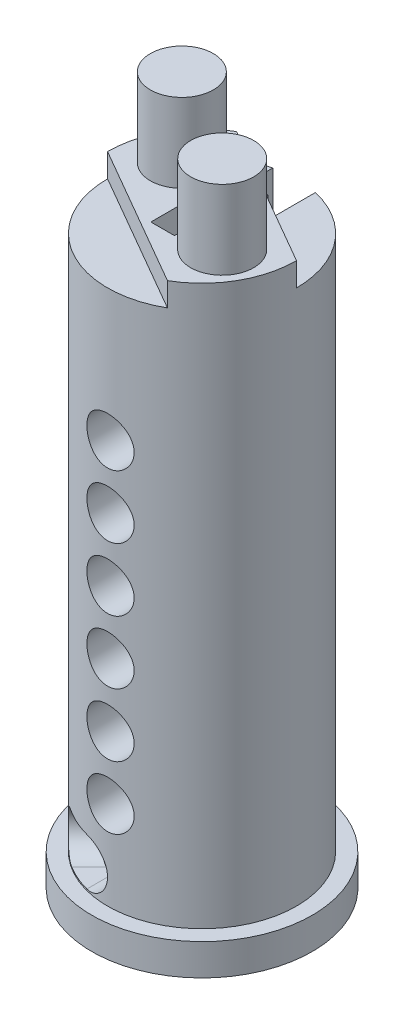
from build123d import *

# Parameters (mm, degrees)
SKETCH_1_R               = 7
EXTRUDE_1_DEPTH          = 2
SKETCH_2_R               = 6
EXTRUDE_2_DEPTH          = 35.5
CUT_EXTRUDE_1_DEPTH      = 39.784661917
CUT_EXTRUDE_1_DEPTH_BACK = 1.5
SKETCH_4_R               = 2
EXTRUDE_3_DEPTH          = 5
CUT_EXTRUDE_2_DEPTH      = 44.637713047
CUT_EXTRUDE_2_DEPTH_BACK = 44.637713047
CUT_EXTRUDE_6_OUTLINE_W  = 1.5
CUT_EXTRUDE_6_OUTLINE_H  = 7.50002714
PATTERN_LINEAR_2_COUNT   = 6
PATTERN_LINEAR_2_PITCH   = 4
CUT_EXTRUDE_7_DEPTH      = 1.5
FILLET_2_R               = 1.5
FILLET_3_R               = 1.5


# Read off the part's stored shape, not the designer's step: 切除-拉伸6
with BuildPart() as part:
    # 草图1 → 凸台-拉伸1 (new body)
    with BuildSketch(Plane(origin=(0, 0, 0), x_dir=(1, 0, 0), z_dir=(0, 1, 0))):
        with Locations(Location((0, 0, 0), (0, 0, 270))):
            Circle(SKETCH_1_R)
    extrude(amount=EXTRUDE_1_DEPTH)

    # 草图2 → 凸台-拉伸2 (add)
    with BuildSketch(Plane(origin=(0, 2, 0), x_dir=(1, 0, 0), z_dir=(0, 1, 0))):
        with Locations(Location((0, 0, 0), (0, 0, 270))):
            Circle(SKETCH_2_R)
    extrude(amount=EXTRUDE_2_DEPTH)

    # 草图3 → 切除-拉伸1 (cut, two sides: drawn at the far end of the back side and taken through both)
    with BuildSketch(Plane(origin=(0, 37.5, 0), x_dir=(1, 0, 0), z_dir=(0, 1, 0)).offset(-CUT_EXTRUDE_1_DEPTH_BACK)):
        with BuildLine():
            Line((0.0612495, -3.49946403), (-3.0612495, -1.696688392))
            ThreePointArc((-3.0612495, -1.696688392), (-1.75, -3.031088913), (0.0612495, -3.49946403))
        make_face()
        with BuildLine():
            ThreePointArc((0.0612495, -3.49946403), (-1.75, -3.031088913), (-3.0612495, -1.696688392))
            Line((-3.0612495, -1.696688392), (-6, 0))
            ThreePointArc((-6, 0), (-3, -5.196152423), (3, -5.196152423))
            Line((3, -5.196152423), (0.0612495, -3.49946403))
        make_face()
        with BuildLine():
            Line((-3, 5.196152423), (-0.0612495, 3.49946403))
            ThreePointArc((-0.0612495, 3.49946403), (1.75, 3.031088913), (3.0612495, 1.696688392))
            Line((3.0612495, 1.696688392), (6, 0))
            ThreePointArc((6, 0), (3, 5.196152423), (-3, 5.196152423))
        make_face()
        with BuildLine():
            ThreePointArc((3.0612495, 1.696688392), (1.75, 3.031088913), (-0.0612495, 3.49946403))
            Line((-0.0612495, 3.49946403), (3.0612495, 1.696688392))
        make_face()
    extrude(amount=CUT_EXTRUDE_1_DEPTH + CUT_EXTRUDE_1_DEPTH_BACK, mode=Mode.SUBTRACT)

    # 草图4 → 凸台-拉伸3 (add)
    with BuildSketch(Plane(origin=(0, 37.5, 0), x_dir=(1, 0, 0), z_dir=(0, 1, 0))):
        with Locations(Location((3.031088913, -1.75, 0), (0, 0, 270))):
            Circle(SKETCH_4_R)
        with Locations(Location((-3.031088913, 1.75, 0), (0, 0, 270))):
            Circle(SKETCH_4_R)
    extrude(amount=EXTRUDE_3_DEPTH)

    # 草图5 → 切除-拉伸2 (cut, two sides: drawn at the far end of the back side and taken through both)
    with BuildSketch(Plane(origin=(0, 0, 0), x_dir=(1, 0, 0), z_dir=(0, 1, 0)).offset(-CUT_EXTRUDE_2_DEPTH_BACK)):
        Polygon((-1.35, 49.247498963), (-1.35, 6.868587919), (-1.35, 4.2), (0, 4.2), (0, 2.7), (-0.75, 2.7), (-0.75, -2.5), (0.75, -2.5), (0.75, 1.5), (1.353400632, 1.5), (1.353400632, 6.867918661), (1.353400632, 49.246829705), (1.374383416, 134.004649195), (-1.329017216, 134.005318453), align=None)
    extrude(amount=CUT_EXTRUDE_2_DEPTH + CUT_EXTRUDE_2_DEPTH_BACK, mode=Mode.SUBTRACT)

    # 切除-拉伸6 outline → 切除-拉伸6 (revolve, cut)
    with BuildSketch(Plane.XZ.offset(-27.6)):
        with Locations((0.75, 2.25001357)):
            Rectangle(CUT_EXTRUDE_6_OUTLINE_W, CUT_EXTRUDE_6_OUTLINE_H)
    cut_extrude_6 = revolve(axis=Axis((0, 27.6, 0), (0, 0, 1)), mode=Mode.SUBTRACT)

    # 阵列(线性)2: 切除-拉伸6 ×6
    with Locations(*[(0, -i * PATTERN_LINEAR_2_PITCH, 0) for i in range(1, PATTERN_LINEAR_2_COUNT)]):
        add(cut_extrude_6, mode=Mode.SUBTRACT)

    # 草图15 → 切除-拉伸7 (cut, symmetric)
    with BuildSketch(Plane(origin=(0, 3.6, 0), x_dir=(1, 0, 0), z_dir=(0, 1, 0))):
        with BuildLine():
            Line((0, -6), (0, -4.5))
            ThreePointArc((0, -4.5), (-1.803051209, -4.122985125), (-3.303979251, -3.055113928))
            Line((-3.303979251, -3.055113928), (-4.36524821, -4.116382886))
            ThreePointArc((-4.36524821, -4.116382886), (-2.377151939, -5.509006141), (0, -6))
        make_face()
    extrude(amount=CUT_EXTRUDE_7_DEPTH, both=True, mode=Mode.SUBTRACT)

    # 圆角2
    fillet_2_edges = [part.edges().sort_by_distance(p)[0] for p in [
        (0, 5.1, 5.25),
        (0, 2.1, 5.25),
    ]]
    fillet(fillet_2_edges, radius=FILLET_2_R - 0.0001)  # a hair under: the kernel refuses the full size

    # 圆角3
    fillet_3_edges = [part.edges().sort_by_distance(p)[0] for p in [
        (-3.83461373, 2.1, 3.585748407),
        (-3.83461373, 5.1, 3.585748407),
    ]]
    fillet(fillet_3_edges, radius=FILLET_3_R - 0.0001)  # a hair under: the kernel refuses the full size


solid = part.part
